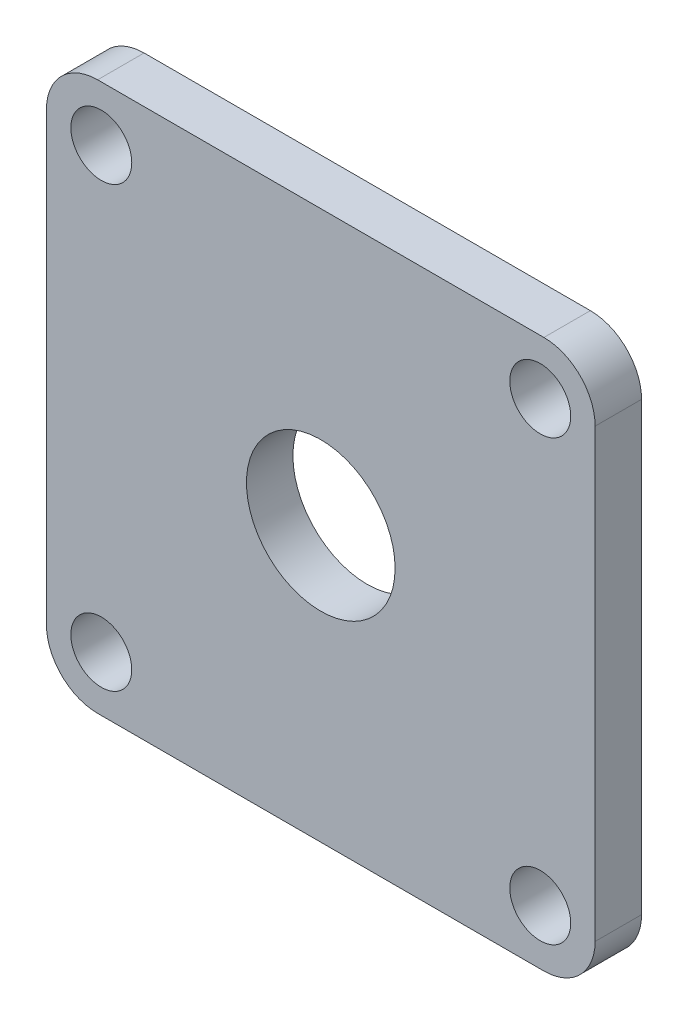
from build123d import *

# Parameters (mm, degrees)
SKETCH1_W           = 75
SKETCH1_H           = 75
BOSS_EXTRUDE1_DEPTH = 6.35
FILLET1_R           = 7
CUT_EXTRUDE1_REACH  = 55.412
SKETCH2_R           = 10.16
CUT_EXTRUDE2_REACH  = 55.412
SKETCH3_R           = 4.165
CIRPATTERN1_COUNT   = 4


with BuildPart() as part:
    # Sketch1 → Boss-Extrude1 (new body)
    with BuildSketch(Plane.XY):
        Rectangle(SKETCH1_W, SKETCH1_H)
    extrude(amount=BOSS_EXTRUDE1_DEPTH)

    # Fillet1
    fillet1_edges = [part.edges().sort_by_distance(p)[0] for p in [
        (-37.5, -37.5, 3.175),
        (37.5, -37.5, 3.175),
        (-37.5, 37.5, 3.175),
        (37.5, 37.5, 3.175),
    ]]
    fillet(fillet1_edges, radius=FILLET1_R)

    # Sketch2 → Cut-Extrude1 (cut, up to next)
    with BuildSketch(Plane.XY.offset(6.35), mode=Mode.PRIVATE) as cut_extrude1_sk1:
        Circle(SKETCH2_R)
    cut_extrude1_tool1 = extrude(cut_extrude1_sk1.sketch, amount=-CUT_EXTRUDE1_REACH, mode=Mode.PRIVATE) & part.part
    add(cut_extrude1_tool1.solids().sort_by_distance((0, 0, 6.35))[0], mode=Mode.SUBTRACT)

    # Sketch3 → Cut-Extrude2 (cut, up to next)
    with BuildSketch(Plane.XY.offset(6.35), mode=Mode.PRIVATE) as cut_extrude2_sk1:
        with Locations((-30, 30)):
            Circle(SKETCH3_R)
    cut_extrude2_tool1 = extrude(cut_extrude2_sk1.sketch, amount=-CUT_EXTRUDE2_REACH, mode=Mode.PRIVATE) & part.part
    cut_extrude2 = cut_extrude2_tool1.solids().sort_by_distance((-30, 30, 6.35))[0]
    add(cut_extrude2, mode=Mode.SUBTRACT)

    # CirPattern1: Cut-Extrude2 ×4 about axis
    cirpattern1_axis = Axis((0, 0, -0.001), (0, 0, 1))
    for i in range(1, CIRPATTERN1_COUNT):
        add(cut_extrude2.rotate(cirpattern1_axis, i * 360 / CIRPATTERN1_COUNT), mode=Mode.SUBTRACT)


solid = part.part
